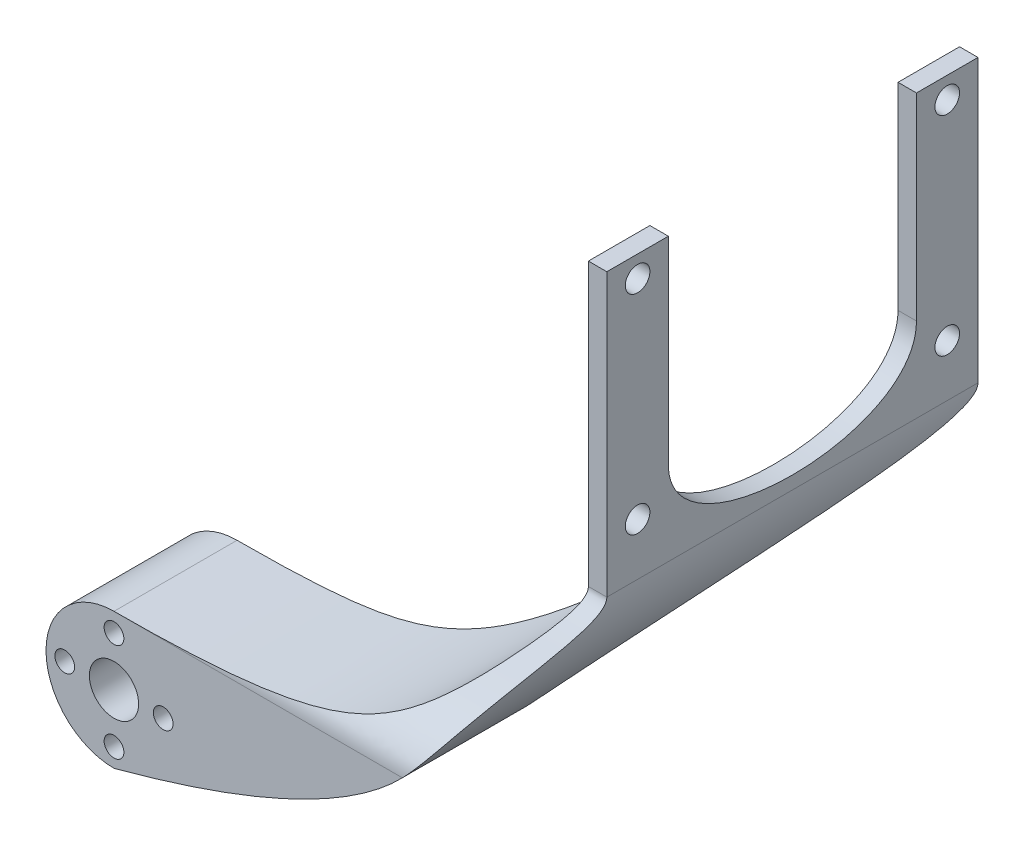
from build123d import *

# Parameters (mm, degrees)
BOSS_EXTRUDE1_START     = -60.5
BOSS_EXTRUDE1_OUTLINE_R = 2
BOSS_EXTRUDE1_DEPTH     = 121
SKETCH1_W               = 179.187175662
SKETCH1_H               = 206.234296517
SKETCH1_R               = 1.6025
SKETCH1_R_2             = 4
CUT_EXTRUDE1_DEPTH      = 80


# Read off the part's stored shape, not the designer's step: Boss-Extrude1
with BuildPart() as part:
    # Boss-Extrude1 outline → Boss-Extrude1 (new body)
    with BuildSketch(Plane(origin=(0, 0, 0), x_dir=(0, 0, -1), z_dir=(1, 0, 0)).offset(BOSS_EXTRUDE1_START)):
        with BuildLine():
            Line((6.0465, 72.85), (6.0465, 27.05))
            add(Edge.make_bspline(
                [(6.0465, 27.05), (6.0465, 21.716666667), (-20, 21.716666667), (-20, 11.05)],
                knots=[0, 0, 0, 0, 1, 1, 1, 1], degree=3))
            Line((-20, 11.05), (-20, -11.05))
            Line((-20, -11.05), (0, -11.05))
            Line((0, -11.05), (0, 11.05))
            add(Edge.make_bspline(
                [(0, 11.05), (0, 19.05), (66.3715, 19.05), (66.3715, 27.05)],
                knots=[0, 0, 0, 0, 1, 1, 1, 1], degree=3))
            Line((66.3715, 27.05), (66.3715, 72.85))
            Line((66.3715, 72.85), (56.3715, 72.85))
            Line((56.3715, 72.85), (56.3715, 40.748146134))
            add(Edge.make_bspline(
                [(56.3715, 40.748146134), (56.3715, 25.284890874), (16.0465, 25.284890874), (16.0465, 40.748146134)],
                knots=[0, 0, 0, 0, 1, 1, 1, 1], degree=3))
            Line((16.0465, 40.748146134), (16.0465, 72.85))
            Line((16.0465, 72.85), (6.0465, 72.85))
        make_face()
        with Locations((11.0465, 35.516666667)):
            Circle(BOSS_EXTRUDE1_OUTLINE_R, mode=Mode.SUBTRACT)
        with Locations((11.0465, 69.383333333)):
            Circle(BOSS_EXTRUDE1_OUTLINE_R, mode=Mode.SUBTRACT)
        with Locations((61.3715, 35.516666667)):
            Circle(BOSS_EXTRUDE1_OUTLINE_R, mode=Mode.SUBTRACT)
        with Locations((61.3715, 69.383333333)):
            Circle(BOSS_EXTRUDE1_OUTLINE_R, mode=Mode.SUBTRACT)
    extrude(amount=BOSS_EXTRUDE1_DEPTH)

    # Sketch1 → Cut-Extrude1 (cut, symmetric)
    # profile 1 of 6: a face of its own
    with BuildSketch(Plane.XY):
        with Locations((-22.097828966, 29.224383364)):
            Rectangle(SKETCH1_W, SKETCH1_H)
        with BuildLine():
            add(Edge.make_bspline(
                [(0, -11.05), (54.05, 3.432653851), (54.05, 27.05)],
                knots=[0, 0, 0, 1, 1, 1], degree=2))
            Line((54.05, 27.05), (54.05, 72.85))
            Line((54.05, 72.85), (51.05, 72.85))
            Line((51.05, 72.85), (51.05, 27.05))
            add(Edge.make_bspline(
                [(0, 11.05), (51.05, 11.05), (51.05, 27.05)],
                knots=[0, 0, 0, 1, 1, 1], degree=2))
            ThreePointArc((0, 11.05), (-11.05, 0), (0, -11.05))
        make_face(mode=Mode.SUBTRACT)
    # profile 2 of 6: a face of its own
    with BuildSketch(Plane.XY):
        with Locations((8, 0)):
            Circle(SKETCH1_R)
    # profile 3 of 6: a face of its own
    with BuildSketch(Plane.XY):
        with Locations((0, 8)):
            Circle(SKETCH1_R)
    # profile 4 of 6: a face of its own
    with BuildSketch(Plane.XY):
        with Locations((-8, 0)):
            Circle(SKETCH1_R)
    # profile 5 of 6: a face of its own
    with BuildSketch(Plane.XY):
        with Locations((0, -8)):
            Circle(SKETCH1_R)
    # profile 6 of 6: a face of its own
    with BuildSketch(Plane.XY):
        Circle(SKETCH1_R_2)
    extrude(amount=CUT_EXTRUDE1_DEPTH, both=True, mode=Mode.SUBTRACT)


solid = part.part
